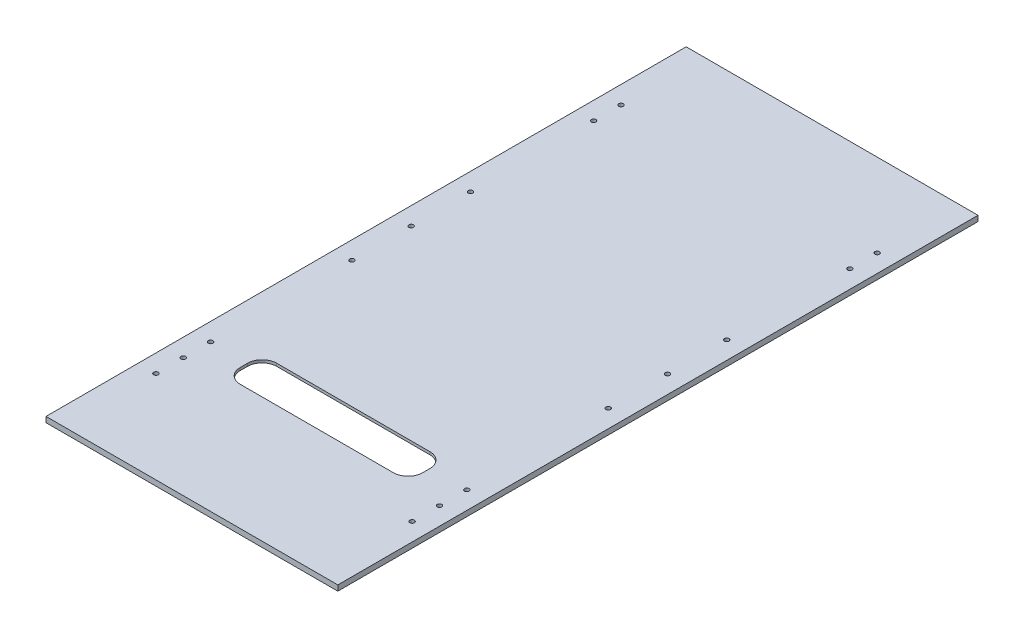
from build123d import *

# Parameters (mm, degrees)
EXTRUDE_1_DEPTH          = 140
EXTRUDE_1_DEPTH_BACK     = 140
EXTRUDE_3_DEPTH          = 35.5
CUT_EXTRUDE_2_REACH      = 197.473
SKETCH_6_W               = 150
SKETCH_6_H               = 80
CUT_EXTRUDE_4_DEPTH      = 6
EXTRUDE_4_DEPTH          = 60.5
CUT_EXTRUDE_START        = -59
CUT_EXTRUDE_6_DEPTH      = 55
CUT_EXTRUDE_START_2      = -4
CUT_EXTRUDE_7_DEPTH      = 27
CUT_EXTRUDE_8_DEPTH      = 35.5
CUT_EXTRUDE_START_3      = -35.5
CUT_EXTRUDE_9_DEPTH      = 35.5
EXTRUDE_5_REACH          = 300.939
SKETCH_25_W              = 121
SKETCH_25_H              = 10
EXTRUDE_6_DEPTH          = 21.5
SKETCH_27_W              = 121
SKETCH_27_H              = 52.5
EXTRUDE_7_DEPTH          = 1.5
SKETCH_28_W              = 121
SKETCH_28_H              = 2
EXTRUDE_8_DEPTH          = 10
CUT_EXTRUDE_11_REACH     = 346.114
SKETCH_29_R              = 2
PATTERN_CIRCULAR_2_COUNT = 10
CUT_EXTRUDE_12_REACH     = 346.114
SKETCH_30_R              = 2
PATTERN_CIRCULAR_3_COUNT = 10
MIRROR_START             = -140
MIRROR_10_OUTLINE_R      = 2
MIRROR_10_DEPTH          = 280
MIRROR_10_2_OUTLINE_R    = 2
MIRROR_10_2_DEPTH        = 4
MIRROR_START_2           = 136
MIRROR_10_3_OUTLINE_R    = 2
MIRROR_10_3_DEPTH        = 4
EXTRUDE_9_REACH          = 263.648
SKETCH_31_W              = 21
SKETCH_31_H              = 16.5
EXTRUDE_10_REACH         = 292.975
SKETCH_34_W              = 121
SKETCH_34_H              = 154
EXTRUDE_11_DEPTH         = 5
EXTRUDE_12_REACH         = 378.928
SKETCH_36_W              = 121
SKETCH_36_H              = 3
EXTRUDE_13_REACH         = 378.928
SKETCH_37_W              = 121
SKETCH_37_H              = 3
SKETCH_38_W              = 100
SKETCH_38_H              = 20
CUT_EXTRUDE_13_DEPTH     = 10
FILLET_1_R               = 8
SKETCH_40_W              = 344.103621996
SKETCH_40_H              = 61.572842363
SKETCH_40_W_2            = 92.051810998
SKETCH_40_H_2            = 3
CUT_EXTRUDE_16_DEPTH     = 399
SKETCH_41_R              = 1.25
CUT_EXTRUDE_17_DEPTH     = 10


# Read off the part's stored shape, not the designer's step: 镜向10
with BuildPart() as part:
    # 草图2 → 凸台-拉伸1 (new, two sides: drawn at the far end of the back side and taken through both)
    with BuildSketch(Plane.XY.offset(-EXTRUDE_1_DEPTH_BACK)):
        with BuildLine():
            Line((60.5, 57), (80, 57))
            add(Edge.make_bspline(
                [(80, 57), (110.715171184, 57), (118.023084898, 36.99301361), (125, 20.498008369), (125, 0)],
                knots=[0, 0, 0, 0, 0, 1, 1, 1, 1, 1], degree=4))
            add(Edge.make_bspline(
                [(80, -57), (110.715171184, -57), (118.023084898, -36.99301361), (125, -20.498008369), (125, 0)],
                knots=[0, 0, 0, 0, 0, 1, 1, 1, 1, 1], degree=4))
            Line((80, -57), (60.5, -57))
            Line((60.5, -57), (60.5, -35.5))
            ThreePointArc((60.5, -35.5), (96, 0), (60.5, 35.5))
            Line((60.5, 35.5), (60.5, 57))
        make_face()
    extrude(amount=EXTRUDE_1_DEPTH + EXTRUDE_1_DEPTH_BACK)

    # 草图5 → 凸台-拉伸3 (add)
    with BuildSketch(Plane.XY.offset(140)):
        with BuildLine():
            Line((60.5, -50), (60.5, -57))
            Line((60.5, -57), (80, -57))
            add(Edge.make_bspline(
                [(80, -57), (110.715171184, -57), (118.023084898, -36.99301361), (125, -20.498008369), (125, 0)],
                knots=[0, 0, 0, 0, 0, 1, 1, 1, 1, 1], degree=4))
            add(Edge.make_bspline(
                [(125, 0), (125, 20.498008369), (118.023084898, 36.99301361), (110.715171184, 57), (80, 57)],
                knots=[0, 0, 0, 0, 0, 1, 1, 1, 1, 1], degree=4))
            Line((80, 57), (60.5, 57))
            Line((60.5, 57), (60.5, 50))
            ThreePointArc((60.5, 50), (110.5, 0), (60.5, -50))
        make_face()
    extrude_3 = extrude(amount=EXTRUDE_3_DEPTH)

    # 镜向2: 凸台-拉伸3 across plane
    add(extrude_3.mirror(Plane.XY))

    # 草图6 → 切除-拉伸2 (cut, up to next)
    with BuildSketch(Plane.ZY.offset(-60.5), mode=Mode.PRIVATE) as cut_extrude_2_sk1:
        with Locations((-15, 0)):
            Rectangle(SKETCH_6_W, SKETCH_6_H)
    cut_extrude_2_tool1 = extrude(cut_extrude_2_sk1.sketch, amount=-CUT_EXTRUDE_2_REACH, mode=Mode.PRIVATE) & part.part
    add(cut_extrude_2_tool1.solids().sort_by_distance((60.5, 0, -15))[0], mode=Mode.SUBTRACT)

    # 草图9 → 切除-拉伸4 (cut, symmetric)
    with BuildSketch(Plane(origin=(0, 0, 0), x_dir=(1, 0, 0), z_dir=(0, 1, 0))):
        Polygon((113.429186382, -60), (119.929186382, -60), (119.929186382, -75), (116.929186382, -75), (111.929186382, -69.041232037), (113.429186382, -67.541232037), align=None)
    cut_extrude_4 = extrude(amount=CUT_EXTRUDE_4_DEPTH, both=True, mode=Mode.SUBTRACT)

    # 镜向3: 切除-拉伸4 across plane
    add(cut_extrude_4.mirror(Plane(origin=(0, 0, -15), x_dir=(1, 0, 0), z_dir=(0, 0, -1))), mode=Mode.SUBTRACT)

    # 草图10 → 凸台-拉伸4 (add)
    with BuildSketch(Plane.ZY.offset(-60.5)):
        Polygon((-90, 40), (-90, 35.5), (-92, 35.5), (-92, 42), (62, 42), (62, 35.5), (60, 35.5), (60, 40), align=None)
    extrude(amount=EXTRUDE_4_DEPTH)

    # 草图18 → 切除-拉伸6 (cut)
    with BuildSketch(Plane.XY.offset(140).offset(CUT_EXTRUDE_START)):
        with BuildLine():
            Line((60.5, 54), (60.5, 35.5))
            ThreePointArc((60.5, 35.5), (96, 0), (60.5, -35.5))
            Line((60.5, -35.5), (60.5, -54))
            Line((60.5, -54), (80, -54))
            add(Edge.make_bspline(
                [(80, -54), (84.874930894, -54), (88.983824843, -53.408674679), (94.293485921, -51.914645093), (95.921328006, -51.314644751), (98.940749379, -49.944603182), (100.332473442, -49.174486853), (102.921509382, -47.489185635), (104.118858715, -46.573864409), (106.351651802, -44.617586852), (107.387031345, -43.57654345), (110.285874468, -40.291394559), (111.943828956, -37.885646851), (114.834227827, -32.778060673), (116.065931681, -30.077252128), (118.174928997, -24.486846885), (119.052306998, -21.597764181), (120.481395372, -15.683640995), (121.033233096, -12.658872533), (121.792444122, -6.461288023), (122, -3.288695832), (122, 0)],
                knots=[0, 0, 0, 0, 0.125, 0.125, 0.1875, 0.1875, 0.25, 0.25, 0.3125, 0.3125, 0.375, 0.375, 0.5, 0.5, 0.625, 0.625, 0.75, 0.75, 0.875, 0.875, 1, 1, 1, 1], degree=3))
            add(Edge.make_bspline(
                [(122, 0), (122, 3.288695832), (121.792444122, 6.461288023), (121.033233096, 12.658872533), (120.481395372, 15.683640995), (119.052306998, 21.597764181), (118.174928997, 24.486846885), (116.065931681, 30.077252128), (114.834227827, 32.778060673), (111.943828956, 37.885646851), (110.285874468, 40.291394559), (107.387031345, 43.57654345), (106.351651802, 44.617586852), (104.118858715, 46.573864409), (102.921509382, 47.489185635), (100.332473442, 49.174486853), (98.940749379, 49.944603182), (95.921328006, 51.314644751), (94.293485921, 51.914645093), (88.983824843, 53.408674679), (84.874930894, 54), (80, 54)],
                knots=[0, 0, 0, 0, 0.125, 0.125, 0.25, 0.25, 0.375, 0.375, 0.5, 0.5, 0.625, 0.625, 0.6875, 0.6875, 0.75, 0.75, 0.8125, 0.8125, 0.875, 0.875, 1, 1, 1, 1], degree=3))
            Line((80, 54), (60.5, 54))
        make_face()
    extrude(amount=CUT_EXTRUDE_6_DEPTH, mode=Mode.SUBTRACT)

    # 草图19 → 切除-拉伸7 (cut)
    with BuildSketch(Plane(origin=(0, 0, -140), x_dir=(-1, 0, 0), z_dir=(0, 0, -1)).offset(CUT_EXTRUDE_START_2)):
        with BuildLine():
            Line((-60.5, 54), (-60.5, 35.5))
            ThreePointArc((-60.5, 35.5), (-96, 0), (-60.5, -35.5))
            Line((-60.5, -35.5), (-60.5, -54))
            Line((-60.5, -54), (-80, -54))
            add(Edge.make_bspline(
                [(-80, -54), (-84.874930894, -54), (-88.983824843, -53.408674679), (-94.293485921, -51.914645093), (-95.921328006, -51.314644751), (-98.940749379, -49.944603182), (-100.332473442, -49.174486853), (-102.921509382, -47.489185635), (-104.118858715, -46.573864409), (-106.351651802, -44.617586852), (-107.387031345, -43.57654345), (-110.285874468, -40.291394559), (-111.943828956, -37.885646851), (-114.834227827, -32.778060673), (-116.065931681, -30.077252128), (-118.174928997, -24.486846885), (-119.052306998, -21.597764181), (-120.481395372, -15.683640995), (-121.033233096, -12.658872533), (-121.792444122, -6.461288023), (-122, -3.288695832), (-122, 0)],
                knots=[0, 0, 0, 0, 0.125, 0.125, 0.1875, 0.1875, 0.25, 0.25, 0.3125, 0.3125, 0.375, 0.375, 0.5, 0.5, 0.625, 0.625, 0.75, 0.75, 0.875, 0.875, 1, 1, 1, 1], degree=3))
            add(Edge.make_bspline(
                [(-122, 0), (-122, 3.288695832), (-121.792444122, 6.461288023), (-121.033233096, 12.658872533), (-120.481395372, 15.683640995), (-119.052306998, 21.597764181), (-118.174928997, 24.486846885), (-116.065931681, 30.077252128), (-114.834227827, 32.778060673), (-111.943828956, 37.885646851), (-110.285874468, 40.291394559), (-107.387031345, 43.57654345), (-106.351651802, 44.617586852), (-104.118858715, 46.573864409), (-102.921509382, 47.489185635), (-100.332473442, 49.174486853), (-98.940749379, 49.944603182), (-95.921328006, 51.314644751), (-94.293485921, 51.914645093), (-88.983824843, 53.408674679), (-84.874930894, 54), (-80, 54)],
                knots=[0, 0, 0, 0, 0.125, 0.125, 0.25, 0.25, 0.375, 0.375, 0.5, 0.5, 0.625, 0.625, 0.6875, 0.6875, 0.75, 0.75, 0.8125, 0.8125, 0.875, 0.875, 1, 1, 1, 1], degree=3))
            Line((-80, 54), (-60.5, 54))
        make_face()
    extrude(amount=-CUT_EXTRUDE_7_DEPTH, mode=Mode.SUBTRACT)

    # 草图20 → 切除-拉伸8 (cut)
    with BuildSketch(Plane.XY.offset(175.5)):
        with BuildLine():
            Line((60.5, 54), (60.5, 50))
            ThreePointArc((60.5, 50), (110.5, 0), (60.5, -50))
            Line((60.5, -50), (60.5, -54))
            Line((60.5, -54), (80, -54))
            add(Edge.make_bspline(
                [(80, -54), (84.874930894, -54), (88.983824843, -53.408674679), (94.293485921, -51.914645093), (95.921328006, -51.314644751), (98.940749379, -49.944603182), (100.332473442, -49.174486853), (102.921509382, -47.489185635), (104.118858715, -46.573864409), (106.351651802, -44.617586852), (107.387031345, -43.57654345), (110.285874468, -40.291394559), (111.943828956, -37.885646851), (114.834227827, -32.778060673), (116.065931681, -30.077252128), (118.174928997, -24.486846885), (119.052306998, -21.597764181), (120.481395372, -15.683640995), (121.033233096, -12.658872533), (121.792444122, -6.461288023), (122, -3.288695832), (122, 0)],
                knots=[0, 0, 0, 0, 0.125, 0.125, 0.1875, 0.1875, 0.25, 0.25, 0.3125, 0.3125, 0.375, 0.375, 0.5, 0.5, 0.625, 0.625, 0.75, 0.75, 0.875, 0.875, 1, 1, 1, 1], degree=3))
            add(Edge.make_bspline(
                [(122, 0), (122, 3.288695832), (121.792444122, 6.461288023), (121.033233096, 12.658872533), (120.481395372, 15.683640995), (119.052306998, 21.597764181), (118.174928997, 24.486846885), (116.065931681, 30.077252128), (114.834227827, 32.778060673), (111.943828956, 37.885646851), (110.285874468, 40.291394559), (107.387031345, 43.57654345), (106.351651802, 44.617586852), (104.118858715, 46.573864409), (102.921509382, 47.489185635), (100.332473442, 49.174486853), (98.940749379, 49.944603182), (95.921328006, 51.314644751), (94.293485921, 51.914645093), (88.983824843, 53.408674679), (84.874930894, 54), (80, 54)],
                knots=[0, 0, 0, 0, 0.125, 0.125, 0.25, 0.25, 0.375, 0.375, 0.5, 0.5, 0.625, 0.625, 0.6875, 0.6875, 0.75, 0.75, 0.8125, 0.8125, 0.875, 0.875, 1, 1, 1, 1], degree=3))
            Line((80, 54), (60.5, 54))
        make_face()
    extrude(amount=-CUT_EXTRUDE_8_DEPTH, mode=Mode.SUBTRACT)

    # 草图21 → 切除-拉伸9 (cut)
    with BuildSketch(Plane(origin=(0, 0, -175.5), x_dir=(-1, 0, 0), z_dir=(0, 0, -1)).offset(CUT_EXTRUDE_START_3)):
        with BuildLine():
            Line((-60.5, -50), (-60.5, -54))
            Line((-60.5, -54), (-80, -54))
            add(Edge.make_bspline(
                [(-80, -54), (-84.874930894, -54), (-88.983824843, -53.408674679), (-94.293485921, -51.914645093), (-95.921328006, -51.314644751), (-98.940749379, -49.944603182), (-100.332473442, -49.174486853), (-102.921509382, -47.489185635), (-104.118858715, -46.573864409), (-106.351651802, -44.617586852), (-107.387031345, -43.57654345), (-110.285874468, -40.291394559), (-111.943828956, -37.885646851), (-114.834227827, -32.778060673), (-116.065931681, -30.077252128), (-118.174928997, -24.486846885), (-119.052306998, -21.597764181), (-120.481395372, -15.683640995), (-121.033233096, -12.658872533), (-121.792444122, -6.461288023), (-122, -3.288695832), (-122, 0)],
                knots=[0, 0, 0, 0, 0.125, 0.125, 0.1875, 0.1875, 0.25, 0.25, 0.3125, 0.3125, 0.375, 0.375, 0.5, 0.5, 0.625, 0.625, 0.75, 0.75, 0.875, 0.875, 1, 1, 1, 1], degree=3))
            add(Edge.make_bspline(
                [(-122, 0), (-122, 3.288695832), (-121.792444122, 6.461288023), (-121.033233096, 12.658872533), (-120.481395372, 15.683640995), (-119.052306998, 21.597764181), (-118.174928997, 24.486846885), (-116.065931681, 30.077252128), (-114.834227827, 32.778060673), (-111.943828956, 37.885646851), (-110.285874468, 40.291394559), (-107.387031345, 43.57654345), (-106.351651802, 44.617586852), (-104.118858715, 46.573864409), (-102.921509382, 47.489185635), (-100.332473442, 49.174486853), (-98.940749379, 49.944603182), (-95.921328006, 51.314644751), (-94.293485921, 51.914645093), (-88.983824843, 53.408674679), (-84.874930894, 54), (-80, 54)],
                knots=[0, 0, 0, 0, 0.125, 0.125, 0.25, 0.25, 0.375, 0.375, 0.5, 0.5, 0.625, 0.625, 0.6875, 0.6875, 0.75, 0.75, 0.8125, 0.8125, 0.875, 0.875, 1, 1, 1, 1], degree=3))
            Line((-80, 54), (-60.5, 54))
            Line((-60.5, 54), (-60.5, 50))
            ThreePointArc((-60.5, 50), (-110.5, 0), (-60.5, -50))
        make_face()
    extrude(amount=CUT_EXTRUDE_9_DEPTH, mode=Mode.SUBTRACT)

    # 镜向9: part across plane


with BuildPart() as part_1:
    add(part.part)
    add(part.part.mirror(Plane.ZY))

    # 草图23 → 凸台-拉伸5 (add, up to next)
    with BuildSketch(Plane.XY.offset(-90), mode=Mode.PRIVATE) as extrude_5_sk1:
        with BuildLine():
            Line((-114.034351089, 40), (-110, 40))
            Line((-110, 40), (-110, -40))
            Line((-110, -40), (-114.034351089, -40))
            add(Edge.make_bspline(
                [(-114.034351089, -40), (-119.771865737, -31.446745908), (-122.888445187, -21.34184926), (-125, -11.276676628), (-125, 0)],
                knots=[0.449864766, 0.449864766, 0.449864766, 0.449864766, 0.449864766, 1, 1, 1, 1, 1], degree=4))
            add(Edge.make_bspline(
                [(-125, 0), (-125, 11.276676628), (-122.888445187, 21.34184926), (-119.771865737, 31.446745908), (-114.034351089, 40)],
                knots=[0, 0, 0, 0, 0, 0.550135234, 0.550135234, 0.550135234, 0.550135234, 0.550135234], degree=4))
        make_face()
    extrude_5_tool1 = extrude(extrude_5_sk1.sketch, amount=EXTRUDE_5_REACH, mode=Mode.PRIVATE) - part_1.part
    add(extrude_5_tool1.solids().sort_by_distance((-116.2158, 0, -90))[0])

    # 草图25 → 凸台-拉伸6 (add)
    with BuildSketch(Plane(origin=(0, 57, 0), x_dir=(1, 0, 0), z_dir=(0, 1, 0))):
        with Locations((0, -67)):
            Rectangle(SKETCH_25_W, SKETCH_25_H)
    extrude(amount=-EXTRUDE_6_DEPTH)



with BuildPart() as body_2:
    # 草图27 → 凸台-拉伸7 (new body)
    with BuildSketch(Plane(origin=(0, 57, 0), x_dir=(1, 0, 0), z_dir=(0, 1, 0))):
        with Locations((0, -98.25)):
            Rectangle(SKETCH_27_W, SKETCH_27_H)
    extrude(amount=-EXTRUDE_7_DEPTH)


with BuildPart() as part_2:
    add(part_1.part)

    add(body_2.part)  # 凸台-拉伸8 merges body 2
    # 草图28 → 凸台-拉伸8 (add)
    with BuildSketch(Plane(origin=(0, 57, 0), x_dir=(1, 0, 0), z_dir=(0, 1, 0))):
        with Locations((0, -125.5)):
            Rectangle(SKETCH_28_W, SKETCH_28_H)
    extrude(amount=-EXTRUDE_8_DEPTH)

    # 草图29 → 切除-拉伸11 (cut, up to next)
    with BuildSketch(Plane.XY.offset(140), mode=Mode.PRIVATE) as cut_extrude_11_sk1:
        with Locations((-85.186980596, 33.978713764)):
            Circle(SKETCH_29_R)
    cut_extrude_11_tool1 = extrude(cut_extrude_11_sk1.sketch, amount=-CUT_EXTRUDE_11_REACH, mode=Mode.PRIVATE) & part_2.part
    cut_extrude_11 = cut_extrude_11_tool1.solids().sort_by_distance((-85.186981, 33.978714, 140))[0]
    add(cut_extrude_11, mode=Mode.SUBTRACT)

    # 阵列(圆周)2: 切除-拉伸11 ×10 about axis, 6 skipped
    pattern_circular_2_axis = Axis((-60.5, 0, 140), (0, 0, -1))
    add([cut_extrude_11.rotate(pattern_circular_2_axis, i * 360 / PATTERN_CIRCULAR_2_COUNT) for i in range(1, PATTERN_CIRCULAR_2_COUNT) if i not in (1, 2, 3, 4, 5, 6)], mode=Mode.SUBTRACT)

    # 草图30 → 切除-拉伸12 (cut, up to next)
    with BuildSketch(Plane(origin=(0, 0, -140), x_dir=(-1, 0, 0), z_dir=(0, 0, -1)), mode=Mode.PRIVATE) as cut_extrude_12_sk1:
        with Locations(Location((85.186980596, 33.978713764, 0), (0, 0, 180))):
            Circle(SKETCH_30_R)
    cut_extrude_12_tool1 = extrude(cut_extrude_12_sk1.sketch, amount=-CUT_EXTRUDE_12_REACH, mode=Mode.PRIVATE) & part_2.part
    cut_extrude_12 = cut_extrude_12_tool1.solids().sort_by_distance((-85.186981, 33.978714, -140))[0]
    add(cut_extrude_12, mode=Mode.SUBTRACT)

    # 阵列(圆周)3: 切除-拉伸12 ×10 about axis, 6 skipped
    pattern_circular_3_axis = Axis((-60.5, 0, 140), (0, 0, -1))
    add([cut_extrude_12.rotate(pattern_circular_3_axis, i * 360 / PATTERN_CIRCULAR_3_COUNT) for i in range(1, PATTERN_CIRCULAR_3_COUNT) if i not in (1, 2, 3, 4, 5, 6)], mode=Mode.SUBTRACT)

    # 镜向10 outline → 镜向10 (cut)
    with BuildSketch(Plane.XY.offset(MIRROR_START)):
        with Locations((85.186980596, 33.978713764)):
            Circle(MIRROR_10_OUTLINE_R)
    extrude(amount=MIRROR_10_DEPTH, mode=Mode.SUBTRACT)

    # Mirror 10 2 outline → Mirror 10 2 (cut)
    with BuildSketch(Plane.XY.offset(MIRROR_START)):
        with Locations((100.444373684, 12.978713764)):
            Circle(MIRROR_10_2_OUTLINE_R)
        with Locations((100.444373684, -12.978713764)):
            Circle(MIRROR_10_2_OUTLINE_R)
        with Locations((85.186980596, -33.978713764)):
            Circle(MIRROR_10_2_OUTLINE_R)
    extrude(amount=MIRROR_10_2_DEPTH, mode=Mode.SUBTRACT)

    # Mirror 10 3 outline → Mirror 10 3 (cut)
    with BuildSketch(Plane.XY.offset(MIRROR_START_2)):
        with Locations((100.444373684, 12.978713764)):
            Circle(MIRROR_10_3_OUTLINE_R)
        with Locations((100.444373684, -12.978713764)):
            Circle(MIRROR_10_3_OUTLINE_R)
        with Locations((85.186980596, -33.978713764)):
            Circle(MIRROR_10_3_OUTLINE_R)
    extrude(amount=MIRROR_10_3_DEPTH, mode=Mode.SUBTRACT)

    # 草图31 → 凸台-拉伸9 (add, up to next)
    with BuildSketch(Plane(origin=(-60.5, 0, 0), x_dir=(0, 0, -1), z_dir=(1, 0, 0)), mode=Mode.PRIVATE) as extrude_9_sk1:
        with Locations((-70.5, -43.75)):
            Rectangle(SKETCH_31_W, SKETCH_31_H)
    extrude_9_tool1 = extrude(extrude_9_sk1.sketch, amount=EXTRUDE_9_REACH, mode=Mode.PRIVATE) - part_2.part
    # 草图31 → 凸台-拉伸9 (add, up to next)
    with BuildSketch(Plane(origin=(-60.5, 0, 0), x_dir=(0, 0, -1), z_dir=(1, 0, 0)), mode=Mode.PRIVATE) as extrude_9_sk2:
        Polygon((109, -52), (109, -35.5), (90, -35.5), (90, -40), (90, -52), align=None)
    extrude_9_tool2 = extrude(extrude_9_sk2.sketch, amount=EXTRUDE_9_REACH, mode=Mode.PRIVATE) - part_2.part
    add(extrude_9_tool1.solids().sort_by_distance((-60.5, -43.75, 70.5))[0])
    add(extrude_9_tool2.solids().sort_by_distance((-60.5, -43.75, -99.5))[0])

    # 草图33 → 凸台-拉伸10 (add, up to next)
    with BuildSketch(Plane.XY.offset(81), mode=Mode.PRIVATE) as extrude_10_sk1:
        with BuildLine():
            Line((62.5, 54), (62.5, 35.443617197))
            ThreePointArc((62.5, 35.443617197), (61.500397299, 35.4859015), (60.5, 35.5))
            Line((60.5, 35.5), (60.5, 54))
            Line((60.5, 54), (62.5, 54))
        make_face()
    extrude_10_tool1 = extrude(extrude_10_sk1.sketch, amount=EXTRUDE_10_REACH, mode=Mode.PRIVATE) - part_2.part
    extrude_10 = extrude_10_tool1.solids().sort_by_distance((61.500507, 44.740598, 81))[0]
    add(extrude_10)

    # 镜向11: 凸台-拉伸10 across plane
    add(extrude_10.mirror(Plane(origin=(0, 0, 0), x_dir=(0, 0, 1), z_dir=(1, 0, 0))))

    # 草图34 → 凸台-拉伸11 (add)
    with BuildSketch(Plane(origin=(0, 42, 0), x_dir=(1, 0, 0), z_dir=(0, 1, 0))):
        with Locations((0, 15)):
            Rectangle(SKETCH_34_W, SKETCH_34_H)
    extrude(amount=EXTRUDE_11_DEPTH)

    # 草图36 → 凸台-拉伸12 (add, up to next)
    with BuildSketch(Plane.XY.offset(175.5), mode=Mode.PRIVATE) as extrude_12_sk1:
        with Locations((0, 55.5)):
            Rectangle(SKETCH_36_W, SKETCH_36_H)
    extrude_12_tool1 = extrude(extrude_12_sk1.sketch, amount=-EXTRUDE_12_REACH, mode=Mode.PRIVATE) - part_2.part
    add(extrude_12_tool1.solids().sort_by_distance((0, 55.5, 175.5))[0])

    # 草图37 → 凸台-拉伸13 (add, up to next)
    with BuildSketch(Plane(origin=(0, 0, -175.5), x_dir=(-1, 0, 0), z_dir=(0, 0, -1)), mode=Mode.PRIVATE) as extrude_13_sk1:
        with Locations((0, 55.5)):
            Rectangle(SKETCH_37_W, SKETCH_37_H)
    extrude_13_tool1 = extrude(extrude_13_sk1.sketch, amount=-EXTRUDE_13_REACH, mode=Mode.PRIVATE) - part_2.part
    add(extrude_13_tool1.solids().sort_by_distance((0, 55.5, -175.5))[0])

    # 草图38 → 切除-拉伸13 (cut)
    with BuildSketch(Plane.XZ.offset(-55.5)):
        with Locations((0, 97)):
            Rectangle(SKETCH_38_W, SKETCH_38_H)
    extrude(amount=-CUT_EXTRUDE_13_DEPTH, mode=Mode.SUBTRACT)

    # 圆角1
    fillet_1_edges = [part_2.edges().sort_by_distance(p)[0] for p in [
        (50, 56.25, 107),
        (50, 56.25, 87),
        (-50, 56.25, 87),
        (-50, 56.25, 107),
    ]]
    fillet(fillet_1_edges, radius=FILLET_1_R)

    # 草图40 → 切除-拉伸16 (cut)
    with BuildSketch(Plane(origin=(0, 0, -175.5), x_dir=(-1, 0, 0), z_dir=(0, 0, -1))):
        Polygon((-172.051810998, 54), (-172.051810998, -54), (172.051810998, -54), (172.051810998, 54), (80, 54), (-80, 54), align=None)
        with Locations((0, -84.786421182)):
            Rectangle(SKETCH_40_W, SKETCH_40_H)
        with Locations((-126.025905499, 55.5)):
            Rectangle(SKETCH_40_W_2, SKETCH_40_H_2)
        with Locations((126.025905499, 55.5)):
            Rectangle(SKETCH_40_W_2, SKETCH_40_H_2)
    extrude(amount=-CUT_EXTRUDE_16_DEPTH, mode=Mode.SUBTRACT)

    # 草图41 → 切除-拉伸17 (cut)
    with BuildSketch(Plane(origin=(0, 57, 0), x_dir=(1, 0, 0), z_dir=(0, 1, 0))):
        with Locations(Location((-70.25, -95, 0), (0, 0, 270))):
            Circle(SKETCH_41_R)
        with Locations(Location((-70.25, -110, 0), (0, 0, 270))):
            Circle(SKETCH_41_R)
        with Locations(Location((-70.25, -125, 0), (0, 0, 270))):
            Circle(SKETCH_41_R)
        with Locations(Location((-70.25, 130, 0), (0, 0, 270))):
            Circle(SKETCH_41_R)
        with Locations(Location((-70.25, 115, 0), (0, 0, 270))):
            Circle(SKETCH_41_R)
        with Locations(Location((-70.25, 47.5, 0), (0, 0, 270))):
            Circle(SKETCH_41_R)
        with Locations(Location((-70.25, 15, 0), (0, 0, 270))):
            Circle(SKETCH_41_R)
        with Locations(Location((-70.25, -17.5, 0), (0, 0, 270))):
            Circle(SKETCH_41_R)
        with Locations(Location((70.25, -17.5, 0), (0, 0, 270))):
            Circle(SKETCH_41_R)
        with Locations(Location((70.25, 15, 0), (0, 0, 270))):
            Circle(SKETCH_41_R)
        with Locations(Location((70.25, 47.5, 0), (0, 0, 270))):
            Circle(SKETCH_41_R)
        with Locations(Location((70.25, 115, 0), (0, 0, 270))):
            Circle(SKETCH_41_R)
        with Locations(Location((70.25, 130, 0), (0, 0, 270))):
            Circle(SKETCH_41_R)
        with Locations(Location((70.25, -125, 0), (0, 0, 270))):
            Circle(SKETCH_41_R)
        with Locations(Location((70.25, -110, 0), (0, 0, 270))):
            Circle(SKETCH_41_R)
        with Locations(Location((70.25, -95, 0), (0, 0, 270))):
            Circle(SKETCH_41_R)
    extrude(amount=-CUT_EXTRUDE_17_DEPTH, mode=Mode.SUBTRACT)


solid = part_2.part
